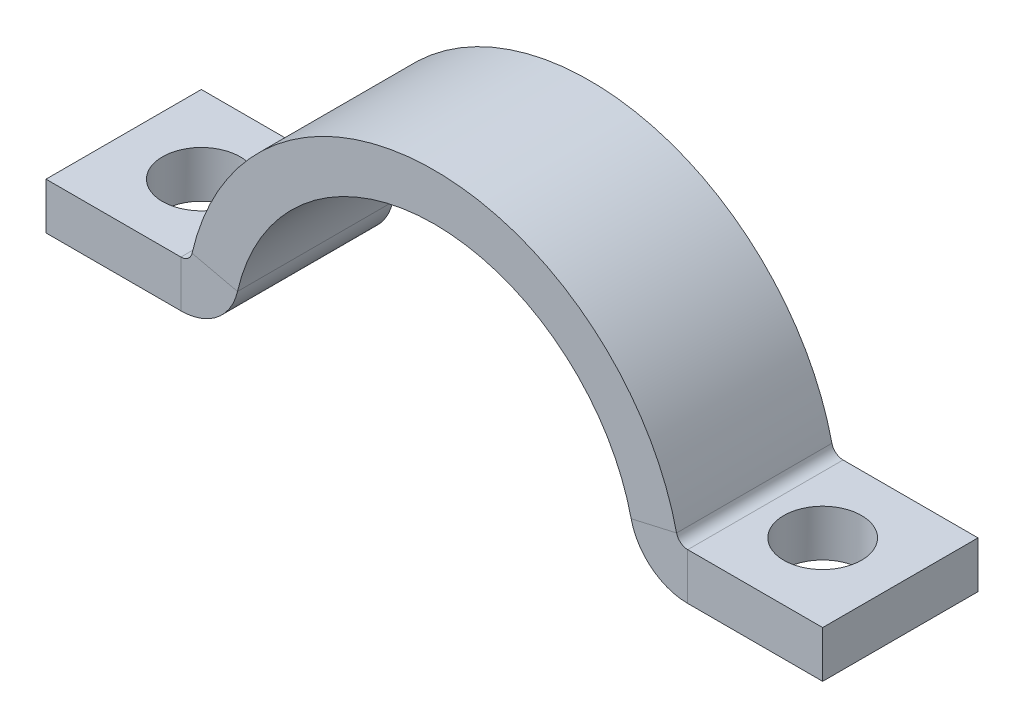
from build123d import *

# Parameters (mm, degrees)
BASE_FLANGE1_START = -5
BASE_FLANGE1_DEPTH = 10
SKETCH6_R          = 2.5
CUT_EXTRUDE1_DEPTH = 10


# Read off the part's stored shape, not the designer's step: Base-Flange1
with BuildPart() as part:
    # Base-Flange1 outline → Base-Flange1 (new body)
    with BuildSketch(Plane.XY.offset(BASE_FLANGE1_START)):
        with BuildLine():
            Line((-16.314153364, 3), (-25, 3))
            Line((-25, 3), (-25, 0))
            Line((-25, 0), (-16.314153364, 0))
            ThreePointArc((-16.314153364, 0), (-13.985527754, 0.814326513), (-12.671868464, 2.902369657))
            ThreePointArc((-12.671868464, 2.902369657), (0, 13), (12.671868464, 2.902369657))
            ThreePointArc((12.671868464, 2.902369657), (13.985527754, 0.814326513), (16.314153364, 0))
            Line((16.314153364, 0), (25, 0))
            Line((25, 0), (25, 3))
            Line((25, 3), (16.314153364, 3))
            ThreePointArc((16.314153364, 3), (15.855108879, 3.160529066), (15.596145802, 3.57214727))
            ThreePointArc((15.596145802, 3.57214727), (0, 16), (-15.596145802, 3.57214727))
            ThreePointArc((-15.596145802, 3.57214727), (-15.855108879, 3.160529066), (-16.314153364, 3))
        make_face()
    extrude(amount=BASE_FLANGE1_DEPTH)

    # Sketch6 → Cut-Extrude1 (cut)
    with BuildSketch(Plane(origin=(0, 3, 0), x_dir=(1, 0, 0), z_dir=(0, 1, 0))):
        with Locations(Location((-20, 0, 0), (0, 0, 270))):
            Circle(SKETCH6_R)
    cut_extrude1 = extrude(amount=-CUT_EXTRUDE1_DEPTH, mode=Mode.SUBTRACT)

    # Mirror1: Cut-Extrude1 across plane
    add(cut_extrude1.mirror(Plane(origin=(0, 0, 0), x_dir=(0, 0, 1), z_dir=(1, 0, 0))), mode=Mode.SUBTRACT)


solid = part.part
